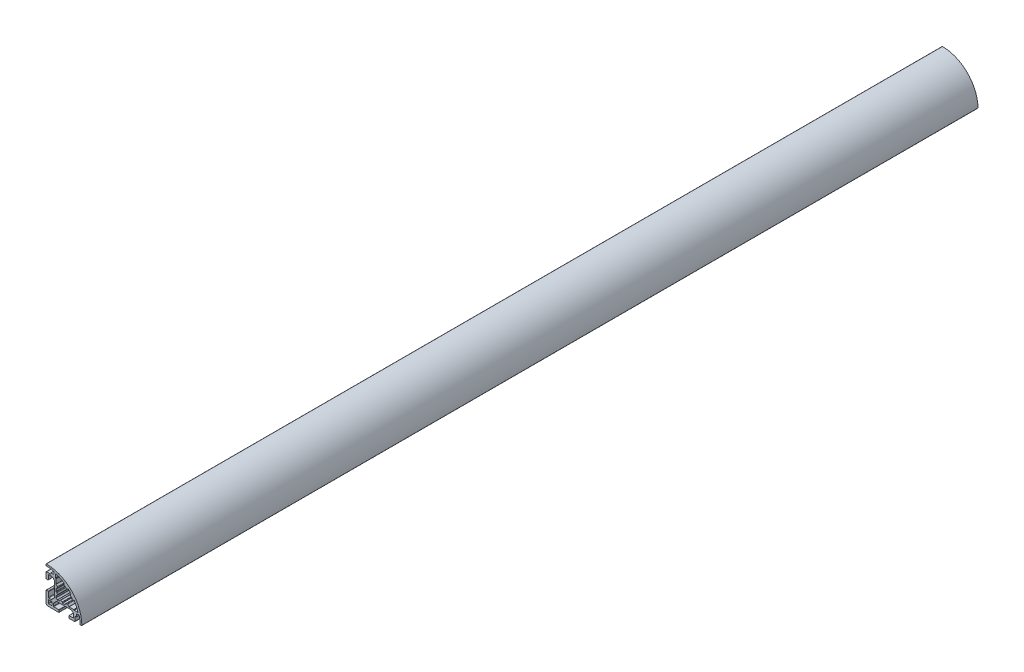
from build123d import *

# Parameters (mm, degrees)
RESSALTO_EXTRUS_O1_DEPTH = 750


with BuildPart() as part:
    # Esboço1 → Ressalto-extrusão1 (new body)
    with BuildSketch(Plane(origin=(0, 0, 0), x_dir=(-1, 0, 0), z_dir=(0, 0, -1))):
        with BuildLine():
            Line((7.988219541, 6.431982835), (8.704487641, 7.07202705))
            Line((8.704487641, 7.07202705), (8.728293149, 7.495764228))
            Line((8.728293149, 7.495764228), (9.151562381, 7.471985009))
            Line((9.151562381, 7.471985009), (9.867827891, 8.112011294))
            ThreePointArc((9.867827891, 8.112011294), (9.965155948, 8.177041539), (10.079961344, 8.199875818))
            Line((10.079961344, 8.199875818), (12.700062747, 8.199833365))
            ThreePointArc((12.700062747, 8.199833365), (12.912193499, 8.11196182), (13.000057886, 7.899828102))
            Line((13.000057886, 7.899828102), (12.999995614, 4.349871124))
            ThreePointArc((12.999995614, 4.349871124), (13.087860246, 4.137737161), (13.299991447, 4.049865862))
            Line((13.299991447, 4.049865862), (14.699990096, 4.049846419))
            ThreePointArc((14.699990096, 4.049846419), (14.912124824, 4.137712911), (14.999994262, 4.349846419))
            Line((14.999994262, 4.349846419), (14.999994262, 8.899908545))
            ThreePointArc((14.999994262, 8.899908545), (14.853547653, 9.253461936), (14.499994262, 9.399908545))
            Line((14.499994262, 9.399908545), (11.299984015, 9.399908545))
            ThreePointArc((11.299984015, 9.399908545), (11.087851981, 9.487776511), (10.999984015, 9.699908545))
            Line((10.999984015, 9.699908545), (10.999984015, 10.199939564))
            ThreePointArc((10.999984015, 10.199939564), (10.91211588, 10.412072007), (10.699983437, 10.499940142))
            Line((10.699983437, 10.499940142), (8.799996289, 10.499940142))
            ThreePointArc((8.799996289, 10.499940142), (8.587864255, 10.587808108), (8.499996289, 10.799940142))
            Line((8.499996289, 10.799940142), (8.499996289, 12.509984621))
            ThreePointArc((8.499996289, 12.509984621), (8.565702422, 12.697351597), (8.734038846, 12.802644177))
            ThreePointArc((8.734038846, 12.802644177), (11.700188414, 13.308311468), (14.703119279, 13.498440079))
            ThreePointArc((14.703119279, 13.498440079), (14.913228295, 13.587399521), (14.999994262, 13.798423803))
            Line((14.999994262, 13.798423803), (14.999994262, 14.698471418))
            ThreePointArc((14.999994262, 14.698471418), (14.911052198, 14.911672141), (14.696963943, 14.998456113))
            ThreePointArc((14.696963943, 14.998456113), (-6.213201777, 6.213195799), (-14.998473404, -14.696965168))
            ThreePointArc((-14.998473404, -14.696965168), (-14.91168949, -14.911053528), (-14.69848871, -14.99999565))
            Line((-14.69848871, -14.99999565), (-13.798441347, -14.99999565))
            ThreePointArc((-13.798441347, -14.99999565), (-13.587416943, -14.913229667), (-13.498457365, -14.70312058))
            ThreePointArc((-13.498457365, -14.70312058), (-13.308326814, -11.700187782), (-12.802657176, -8.734036533))
            ThreePointArc((-12.802657176, -8.734036533), (-12.69756035, -8.565856959), (-12.510499232, -8.499994604))
            Line((-12.510499232, -8.499994604), (-10.800466095, -8.49997976))
            ThreePointArc((-10.800466095, -8.49997976), (-10.588332377, -8.587846805), (-10.500463491, -8.79997976))
            Line((-10.500463491, -8.79997976), (-10.500463491, -10.699963204))
            ThreePointArc((-10.500463491, -10.699963204), (-10.412595525, -10.912095238), (-10.200463491, -10.999963204))
            Line((-10.200463491, -10.999963204), (-9.700412566, -10.999963204))
            ThreePointArc((-9.700412566, -10.999963204), (-9.488279549, -11.087832151), (-9.400412566, -11.299965981))
            Line((-9.400412566, -11.299965981), (-9.400442195, -14.49999102))
            ThreePointArc((-9.400442195, -14.49999102), (-9.253997222, -14.853547404), (-8.900442195, -14.99999565))
            Line((-8.900442195, -14.99999565), (-4.35042854, -14.99999565))
            ThreePointArc((-4.35042854, -14.99999565), (-4.138296996, -14.912128175), (-4.05042854, -14.699997039))
            Line((-4.05042854, -14.699997039), (-4.050422058, -13.299966156))
            ThreePointArc((-4.050422058, -13.299966156), (-4.138289027, -13.087833729), (-4.350420629, -12.999964767))
            Line((-4.350420629, -12.999964767), (-7.900429098, -12.999947852))
            ThreePointArc((-7.900429098, -12.999947852), (-8.112560691, -12.912078899), (-8.200427669, -12.699946488))
            Line((-8.200427669, -12.699946488), (-8.200415758, -10.079879081))
            ThreePointArc((-8.200415758, -10.079879081), (-8.177579097, -9.965074158), (-8.112546833, -9.867747451))
            Line((-8.112546833, -9.867747451), (-7.4724926, -9.151499458))
            Line((-7.4724926, -9.151499458), (-7.496283743, -8.728000464))
            Line((-7.496283743, -8.728000464), (-7.072671368, -8.704202951))
            Line((-7.072671368, -8.704202951), (-6.432617133, -7.987954957))
            ThreePointArc((-6.432617133, -7.987954957), (-6.335289818, -7.922923563), (-6.220484665, -7.900087947))
            Line((-6.220484665, -7.900087947), (6.219717687, -7.900145542))
            ThreePointArc((6.219717687, -7.900145542), (6.334521962, -7.922981945), (6.431848321, -7.988013496))
            Line((6.431848321, -7.988013496), (8.711747832, -10.467916072))
            ThreePointArc((8.711747832, -10.467916072), (8.776785994, -10.565245573), (8.799624849, -10.680055769))
            Line((8.799624849, -10.680055769), (8.799634202, -12.700073336))
            ThreePointArc((8.799634202, -12.700073336), (8.711767024, -12.912205971), (8.499635043, -13.000074725))
            Line((8.499635043, -13.000074725), (4.349626042, -13.000086362))
            ThreePointArc((4.349626042, -13.000086362), (4.137495042, -13.087954134), (4.049626883, -13.300084973))
            Line((4.049626883, -13.300084973), (4.049620402, -14.699994261))
            ThreePointArc((4.049620402, -14.699994261), (4.137487877, -14.912127193), (4.349620402, -14.99999565))
            Line((4.349620402, -14.99999565), (13.499994262, -14.99999565))
            ThreePointArc((13.499994262, -14.99999565), (14.560654434, -14.560655822), (14.999994262, -13.49999565))
            Line((14.999994262, -13.49999565), (14.999994262, -4.350307853))
            ThreePointArc((14.999994262, -4.350307853), (14.912126297, -4.138175819), (14.699994262, -4.050307853))
            Line((14.699994262, -4.050307853), (13.299941692, -4.050307853))
            ThreePointArc((13.299941692, -4.050307853), (13.087809804, -4.138175672), (12.999941692, -4.350307438))
            Line((12.999941692, -4.350307438), (12.999935957, -8.500264661))
            ThreePointArc((12.999935957, -8.500264661), (12.912067599, -8.712396673), (12.699935263, -8.800264247))
            Line((12.699935263, -8.800264247), (10.679833903, -8.800259571))
            ThreePointArc((10.679833903, -8.800259571), (10.565028929, -8.777423166), (10.467702076, -8.712391118))
            Line((10.467702076, -8.712391118), (7.987808147, -6.432485885))
            ThreePointArc((7.987808147, -6.432485885), (7.922994822, -6.335109576), (7.900348133, -6.220348782))
            Line((7.900348133, -6.220348782), (7.900348133, 6.219847358))
            ThreePointArc((7.900348133, 6.219847358), (7.923185205, 6.334654636), (7.988219541, 6.431982835))
        make_face()
        with BuildLine():
            Line((12.699997649, -12.999995366), (10.299997649, -12.999995366))
            ThreePointArc((10.299997649, -12.999995366), (10.087865615, -12.9121274), (9.999997649, -12.699995366))
            Line((9.999997649, -12.699995366), (9.999997649, -10.299995366))
            ThreePointArc((9.999997649, -10.299995366), (10.087865615, -10.087863332), (10.299997649, -9.999995366))
            Line((10.299997649, -9.999995366), (12.699997649, -9.999995366))
            ThreePointArc((12.699997649, -9.999995366), (12.912129683, -10.087863332), (12.999997649, -10.299995366))
            Line((12.999997649, -10.299995366), (12.999997649, -12.699995366))
            ThreePointArc((12.999997649, -12.699995366), (12.912129683, -12.9121274), (12.699997649, -12.999995366))
        make_face(mode=Mode.SUBTRACT)
        with BuildLine():
            Line((-0.949997542, 6.699991608), (-0.300006198, 6.699991608))
            ThreePointArc((-0.300006198, 6.699991608), (-0.087874164, 6.787859574), (-6.198e-06, 6.999991608))
            Line((-6.198e-06, 6.999991608), (-6.198e-06, 8.47764802))
            ThreePointArc((-6.198e-06, 8.47764802), (0.037542168, 8.622972279), (0.140788069, 8.731918614))
            ThreePointArc((0.140788069, 8.731918614), (3.280244614, 10.429262729), (6.61010457, 11.713473425))
            ThreePointArc((6.61010457, 11.713473425), (6.877524397, 11.669091748), (6.999996226, 11.427257614))
            Line((6.999996226, 11.427257614), (6.999996226, 8.679894243))
            ThreePointArc((6.999996226, 8.679894243), (6.977160088, 8.565089218), (6.912128268, 8.467762216))
            Line((6.912128268, 8.467762216), (6.787851146, 8.343485086))
            ThreePointArc((6.787851146, 8.343485086), (6.722819326, 8.246158084), (6.699983188, 8.131353059))
            Line((6.699983188, 8.131353059), (6.699983188, 4.349373523))
            ThreePointArc((6.699983188, 4.349373523), (6.677147048, 4.234568493), (6.612115222, 4.137241489))
            Line((6.612115222, 4.137241489), (5.487142739, 3.012269005))
            ThreePointArc((5.487142739, 3.012269005), (5.403317864, 2.849223708), (5.430017697, 2.667847035))
            ThreePointArc((5.430017697, 2.667847035), (5.679815237, 2.083794343), (5.866996881, 1.47676931))
            ThreePointArc((5.866996881, 1.47676931), (5.973488711, 1.313387662), (6.157922346, 1.249997541))
            Line((6.157922346, 1.249997541), (6.399983188, 1.249997541))
            ThreePointArc((6.399983188, 1.249997541), (6.612115222, 1.162129575), (6.699983188, 0.949997541))
            Line((6.699983188, 0.949997541), (6.699983188, -0.949997542))
            ThreePointArc((6.699983188, -0.949997542), (6.612115222, -1.162129576), (6.399983188, -1.249997542))
            Line((6.399983188, -1.249997542), (6.157922346, -1.249997542))
            ThreePointArc((6.157922346, -1.249997542), (5.973488711, -1.313387663), (5.866996881, -1.476769311))
            ThreePointArc((5.866996881, -1.476769311), (5.679815237, -2.083794344), (5.430017697, -2.667847036))
            ThreePointArc((5.430017697, -2.667847036), (5.403317864, -2.849223709), (5.487142739, -3.012269006))
            Line((5.487142739, -3.012269006), (6.612115222, -4.13724149))
            ThreePointArc((6.612115222, -4.13724149), (6.677147048, -4.234568494), (6.699983188, -4.349373524))
            Line((6.699983188, -4.349373524), (6.699983188, -5.439573887))
            ThreePointArc((6.699983188, -5.439573887), (6.677147048, -5.554378917), (6.612115222, -5.651705921))
            Line((6.612115222, -5.651705921), (5.651680826, -6.612140317))
            ThreePointArc((5.651680826, -6.612140317), (5.554353822, -6.677172143), (5.439548792, -6.700008283))
            Line((5.439548792, -6.700008283), (4.349398617, -6.700008283))
            ThreePointArc((4.349398617, -6.700008283), (4.234593588, -6.677172143), (4.137266583, -6.612140317))
            Line((4.137266583, -6.612140317), (3.012269005, -5.48714274))
            ThreePointArc((3.012269005, -5.48714274), (2.849223708, -5.403317864), (2.667847035, -5.430017698))
            ThreePointArc((2.667847035, -5.430017698), (2.083794343, -5.679815238), (1.47676931, -5.866996882))
            ThreePointArc((1.47676931, -5.866996882), (1.313387662, -5.973488713), (1.24999754, -6.157922347))
            Line((1.24999754, -6.157922347), (1.24999754, -6.400008283))
            ThreePointArc((1.24999754, -6.400008283), (1.162129575, -6.612140317), (0.94999754, -6.700008283))
            Line((0.94999754, -6.700008283), (-0.949997542, -6.700008283))
            ThreePointArc((-0.949997542, -6.700008283), (-1.162129576, -6.612140317), (-1.249997542, -6.400008283))
            Line((-1.249997542, -6.400008283), (-1.249997542, -6.157922347))
            ThreePointArc((-1.249997542, -6.157922347), (-1.313387663, -5.973488713), (-1.476769311, -5.866996882))
            ThreePointArc((-1.476769311, -5.866996882), (-2.083794344, -5.679815238), (-2.667847036, -5.430017698))
            ThreePointArc((-2.667847036, -5.430017698), (-2.849223709, -5.403317865), (-3.012269006, -5.48714274))
            Line((-3.012269006, -5.48714274), (-4.137266583, -6.612140317))
            ThreePointArc((-4.137266583, -6.612140317), (-4.234593588, -6.677172143), (-4.349398618, -6.700008283))
            Line((-4.349398618, -6.700008283), (-8.131377093, -6.700008283))
            ThreePointArc((-8.131377093, -6.700008283), (-8.246182127, -6.722844425), (-8.343509135, -6.787876256))
            Line((-8.343509135, -6.787876256), (-8.467778577, -6.912145707))
            ThreePointArc((-8.467778577, -6.912145707), (-8.565105584, -6.977177538), (-8.679910619, -7.00001368))
            Line((-8.679910619, -7.00001368), (-11.427275069, -7.00001368))
            ThreePointArc((-11.427275069, -7.00001368), (-11.669109203, -6.877541852), (-11.713490879, -6.610122025))
            ThreePointArc((-11.713490879, -6.610122025), (-10.429280184, -3.280262068), (-8.731936068, -0.140805524))
            ThreePointArc((-8.731936068, -0.140805524), (-8.622989733, -0.037559623), (-8.477665474, -1.1256e-05))
            Line((-8.477665474, -1.1256e-05), (-7.000004228, -1.1256e-05))
            ThreePointArc((-7.000004228, -1.1256e-05), (-6.787872194, 0.08785671), (-6.700004228, 0.299988744))
            Line((-6.700004228, 0.299988744), (-6.700004228, 0.94999754))
            ThreePointArc((-6.700004228, 0.94999754), (-6.612136263, 1.162129574), (-6.400004228, 1.24999754))
            Line((-6.400004228, 1.24999754), (-6.157922347, 1.24999754))
            ThreePointArc((-6.157922347, 1.24999754), (-5.973488713, 1.313387661), (-5.866996882, 1.476769309))
            ThreePointArc((-5.866996882, 1.476769309), (-5.679815238, 2.083794343), (-5.430017698, 2.667847035))
            ThreePointArc((-5.430017698, 2.667847035), (-5.403317865, 2.849223708), (-5.48714274, 3.012269005))
            Line((-5.48714274, 3.012269005), (-5.797444779, 3.322571045))
            ThreePointArc((-5.797444779, 3.322571045), (-5.885209902, 3.526848471), (-5.808258232, 3.735439996))
            ThreePointArc((-5.808258232, 3.735439996), (-4.798993375, 4.798993588), (-3.735438882, 5.808257496))
            ThreePointArc((-3.735438882, 5.808257496), (-3.526847423, 5.885208983), (-3.322570131, 5.797443864))
            Line((-3.322570131, 5.797443864), (-3.012269006, 5.487142739))
            ThreePointArc((-3.012269006, 5.487142739), (-2.849223709, 5.403317864), (-2.667847036, 5.430017697))
            ThreePointArc((-2.667847036, 5.430017697), (-2.083794344, 5.679815237), (-1.476769311, 5.866996881))
            ThreePointArc((-1.476769311, 5.866996881), (-1.313387663, 5.973488711), (-1.249997542, 6.157922346))
            Line((-1.249997542, 6.157922346), (-1.249997542, 6.399991608))
            ThreePointArc((-1.249997542, 6.399991608), (-1.162129576, 6.612123643), (-0.949997542, 6.699991608))
        make_face(mode=Mode.SUBTRACT)
    extrude(amount=-RESSALTO_EXTRUS_O1_DEPTH)


solid = part.part
